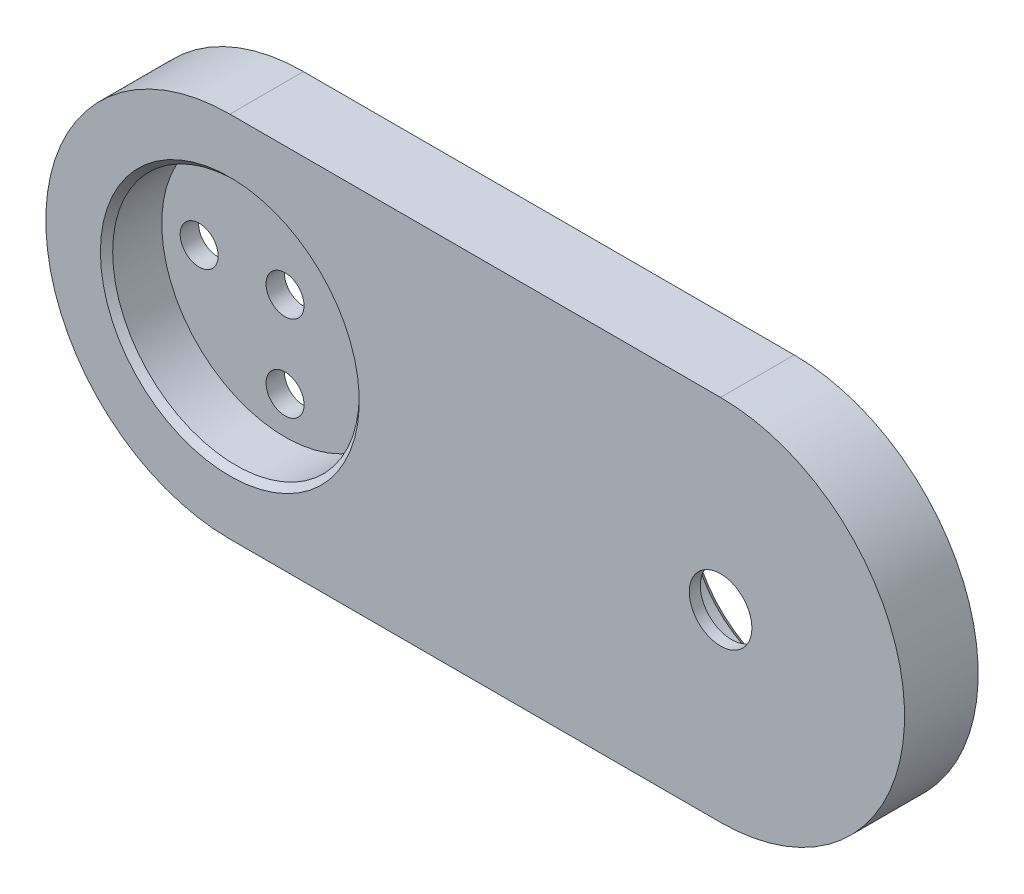
from build123d import *

# Parameters (mm, degrees)
BOSS_EXTRUDE1_DEPTH = 6
SKETCH8_R           = 10.05
CUT_EXTRUDE4_DEPTH  = 4.5
SKETCH9_R           = 7.975
CUT_EXTRUDE5_DEPTH  = 5.1
SKETCH10_R          = 2.55
CUT_EXTRUDE6_DEPTH  = 39.418875569
SKETCH11_R          = 1.55
CUT_EXTRUDE7_DEPTH  = 39.34383914
CHAMFER1_SIZE       = 0.5


with BuildPart() as part:
    # Sketch4 → Boss-Extrude1 (new body)
    with BuildSketch(Plane.XY):
        with BuildLine():
            Line((-20, 15), (20, 15))
            ThreePointArc((20, 15), (35, 0), (20, -15))
            Line((20, -15), (-20, -15))
            ThreePointArc((-20, -15), (-35, 0), (-20, 15))
        make_face()
    extrude(amount=BOSS_EXTRUDE1_DEPTH)

    # Sketch8 → Cut-Extrude4 (cut)
    with BuildSketch(Plane.XY.offset(6)):
        with Locations((-20, 0)):
            Circle(SKETCH8_R)
    extrude(amount=-CUT_EXTRUDE4_DEPTH, mode=Mode.SUBTRACT)

    # Sketch9 → Cut-Extrude5 (cut)
    with BuildSketch(Plane(origin=(0, 0, 0), x_dir=(-1, 0, 0), z_dir=(0, 0, -1))):
        with Locations((-20, 0)):
            Circle(SKETCH9_R)
    extrude(amount=-CUT_EXTRUDE5_DEPTH, mode=Mode.SUBTRACT)

    # Sketch10 → Cut-Extrude6 (cut, through all)
    with BuildSketch(Plane(origin=(0, 0, 5.1), x_dir=(-1, 0, 0), z_dir=(0, 0, -1))):
        with Locations((-20, 0)):
            Circle(SKETCH10_R)
    extrude(amount=-CUT_EXTRUDE6_DEPTH, mode=Mode.SUBTRACT)

    # Sketch11 → Cut-Extrude7 (cut, through all)
    with BuildSketch(Plane.XY.offset(1.5)):
        with Locations((-20, 0)):
            Circle(SKETCH11_R)
        with Locations((-13, 0)):
            Circle(SKETCH11_R)
        with Locations((-27, 0)):
            Circle(SKETCH11_R)
        with Locations((-20, 7)):
            Circle(SKETCH11_R)
        with Locations((-20, -7)):
            Circle(SKETCH11_R)
    extrude(amount=-CUT_EXTRUDE7_DEPTH, mode=Mode.SUBTRACT)

    # Chamfer1
    chamfer1_edges = [part.edges().sort_by_distance(p)[0] for p in [
        (27.975, 0, 0),
        (-30.05, 0, 6),
    ]]
    chamfer(chamfer1_edges, length=CHAMFER1_SIZE)


solid = part.part
